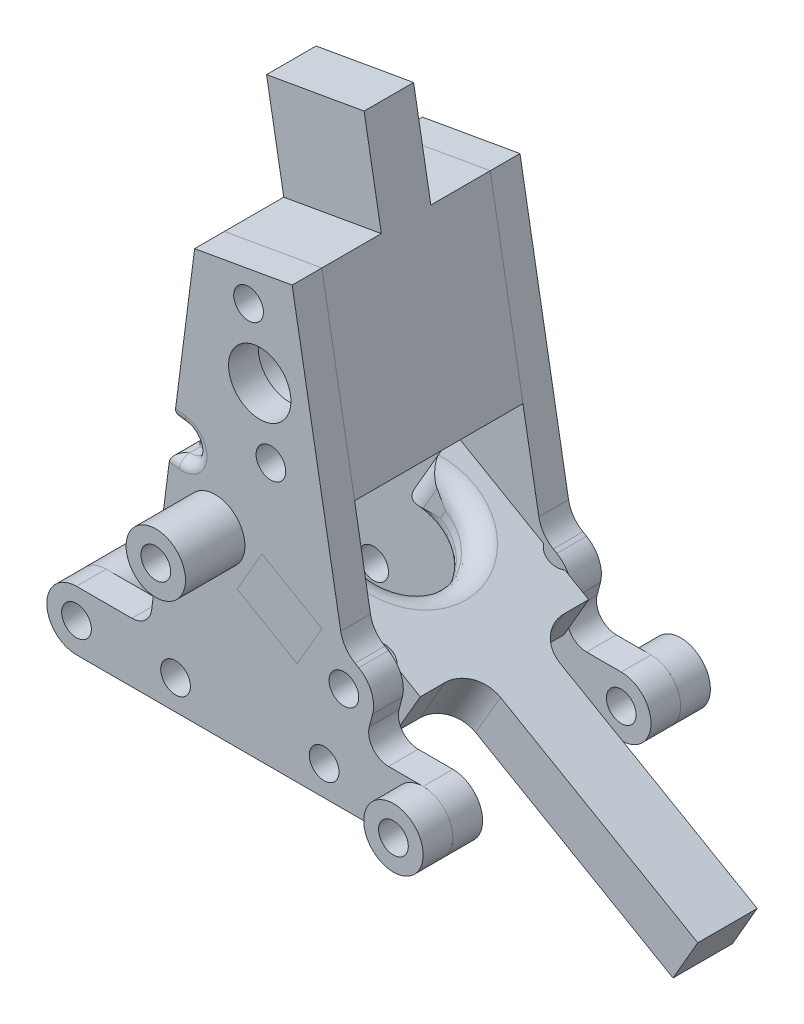
from build123d import *

# Parameters (mm, degrees)
SKETCH_1_R             = 1.5
SKETCH_1_R_2           = 3.15
EXTRUDE_1_DEPTH        = 3
EXTRUDE_START          = -3
SKETCH_6_R             = 1.5
EXTRUDE_5_DEPTH        = 3
FILLET_2_R             = 2
CUT_EXTRUDE_3_DEPTH    = 50.101561086
FILLET_5_R             = 1
PATTERN_LINEAR_1_COUNT = 2
PATTERN_LINEAR_1_PITCH = 20
EXTRUDE_2_REACH        = 54.934
SKETCH_2_R             = 3.45
SKETCH_2_R_2           = 1.6
SKETCH_3_W             = 10
SKETCH_3_H             = 5
EXTRUDE_3_DEPTH        = 10
EXTRUDE_4_DEPTH        = 2.5
OTHER_START            = -0.045495013
OTHER_1_OUTLINE_W      = 5
OTHER_1_OUTLINE_H      = 3
OTHER_1_DEPTH          = 7
OTHER_2_OUTLINE_W      = 5
OTHER_2_OUTLINE_H      = 3
OTHER_2_DEPTH          = 7
FILLET_1_R             = 3
CHAMFER_1_SIZE         = 3
SKETCH_8_R             = 3
SKETCH_8_R_2           = 1.5
EXTRUDE_6_DEPTH        = 17
SKETCH_9_R             = 1.25
CUT_EXTRUDE_1_DEPTH    = 5
CUT_EXTRUDE_2_REACH    = 55.629
SKETCH_11_R            = 3
SKETCH_11_R_2          = 1.5
EXTRUDE_7_DEPTH        = 6
SKETCH_12_R            = 3
SKETCH_12_R_2          = 1.5
EXTRUDE_8_DEPTH        = 3
FILLET_3_R             = 2
FILLET_4_R             = 2


# Read off the part's stored shape, not the designer's step: ｲﾝﾃﾞﾝﾄ1, ｲﾝﾃﾞﾝﾄ2
# Some blends are built 0.0001 mm under size
with BuildPart() as part:
    # ｽｹｯﾁ1 → ﾎﾞｽ - 押し出し1 (new body)
    with BuildSketch(Plane.XY):
        with BuildLine():
            Line((1.926303547, 38.487432765), (11.774381077, 40.223914542))
            Line((11.774381077, 40.223914542), (16.678379769, 12.411955915))
            ThreePointArc((16.678379769, 12.411955915), (17.175346896, 11.212171139), (18.132803029, 10.334824237))
            Line((18.132803029, 10.334824237), (18.495190528, 10.125599716))
            ThreePointArc((18.495190528, 10.125599716), (19.765274197, 8.679320566), (19.895057261, 6.75890596))
            Line((19.895057261, 6.75890596), (17.899866733, -0.768617545))
            ThreePointArc((17.899866733, -0.768617545), (16.829500938, -2.377588341), (15, -3))
            Line((15, -3), (0, -3))
            ThreePointArc((0, -3), (-2.252587178, -1.981376038), (-2.975481506, 0.382765997))
            Line((-2.975481506, 0.382765997), (1.926303547, 38.487432765))
        make_face()
        Circle(SKETCH_1_R, mode=Mode.SUBTRACT)
        with Locations((15, 0)):
            Circle(SKETCH_1_R, mode=Mode.SUBTRACT)
        with Locations((16.995190528, 7.527523505)):
            Circle(SKETCH_1_R, mode=Mode.SUBTRACT)
        with Locations((4.004809472, 15.027523505)):
            Circle(SKETCH_1_R, mode=Mode.SUBTRACT)
        with Locations((8.5, 30)):
            Circle(SKETCH_1_R_2, mode=Mode.SUBTRACT)
        with Locations((7.371286845, 36.401250395)):
            Circle(SKETCH_1_R, mode=Mode.SUBTRACT)
        with Locations(Location((9.628713155, 23.598749605, 0), (0, 0, 180))):
            Circle(SKETCH_1_R, mode=Mode.SUBTRACT)
    extrude(amount=EXTRUDE_1_DEPTH)

    # ｽｹｯﾁ6 → ﾎﾞｽ - 押し出し5 (add)
    # profile 1 of 2: a face of its own
    with BuildSketch(Plane.XY.offset(3).offset(EXTRUDE_START)):
        with BuildLine():
            Line((-2.638800474, 3), (-10, 3))
            ThreePointArc((-10, 3), (-13, 0), (-10, -3))
            Line((-10, -3), (0, -3))
            ThreePointArc((0, -3), (-2.252587178, -1.981376038), (-2.975481506, 0.382765997))
            Line((-2.975481506, 0.382765997), (-2.638800474, 3))
        make_face()
        with Locations((-10, 0)):
            Circle(SKETCH_6_R, mode=Mode.SUBTRACT)
    # profile 2 of 2: a face of its own
    with BuildSketch(Plane.XY.offset(3).offset(EXTRUDE_START)):
        with BuildLine():
            Line((15, -3), (25, -3))
            ThreePointArc((25, -3), (28, 0), (25, 3))
            Line((25, 3), (18.898749038, 3))
            Line((18.898749038, 3), (17.899866733, -0.768617545))
            ThreePointArc((17.899866733, -0.768617545), (16.829500938, -2.377588341), (15, -3))
        make_face()
        with Locations((25, 0)):
            Circle(SKETCH_6_R, mode=Mode.SUBTRACT)
    extrude(amount=EXTRUDE_5_DEPTH)

    # ﾌｨﾚｯﾄ2
    fillet_2_edges = [part.edges().sort_by_distance(p)[0] for p in [
        (18.898749038, 3, 1.5),
        (-2.638800474, 3, 1.5),
    ]]
    fillet(fillet_2_edges, radius=FILLET_2_R)

    # ｽｹｯﾁ13 → ｶｯﾄ - 押し出し3 (cut, through all)
    with BuildSketch(Plane.XY.offset(3)):
        with BuildLine():
            Line((-1.117064807, 22.667097894), (0.866589531, 22.411920563))
            ThreePointArc((0.866589531, 22.411920563), (2.162947285, 20.732796811), (0.483823534, 19.436439057))
            Line((0.483823534, 19.436439057), (-1.499830804, 19.691616388))
            ThreePointArc((-1.499830804, 19.691616388), (-2.796188558, 21.37074014), (-1.117064807, 22.667097894))
        make_face()
    extrude(amount=-CUT_EXTRUDE_3_DEPTH, mode=Mode.SUBTRACT)

    # ﾌｨﾚｯﾄ5
    fillet_5_edges = [part.edges().sort_by_distance(p)[0] for p in [
        (-0.508003635, 19.564027723, 1.5),
        (-0.125237638, 22.539509228, 1.5),
        (0.370675946, 22.475714896, 0),
        (-0.012090051, 19.50023339, 0),
        (0.370675946, 22.475714896, 3),
        (-0.012090051, 19.50023339, 3),
        (2.162947285, 20.732796811, 3),
        (2.162947285, 20.732796811, 0),
    ]]
    fillet(fillet_5_edges, radius=FILLET_5_R - 0.0001)  # a hair under: the kernel refuses the full size


with BuildPart() as pattern_linear_1_1:
    # 直線ﾊﾟﾀｰﾝ1: pattern copy
    add(part.part.moved(Location(Vector(0, 0, -1) * (1 * PATTERN_LINEAR_1_PITCH))))


with BuildPart() as body_3:

    # ｽｹｯﾁ2 → ﾎﾞｽ - 押し出し2 (new, up to next)
    with BuildSketch(Plane(origin=(0, 0, 0), x_dir=(-1, 0, 0), z_dir=(0, 0, -1)), mode=Mode.PRIVATE) as extrude_2_sk1:
        Polygon((-1.926303547, 38.487432765), (-5.225618923, 19.776085458), (-15.073696453, 21.512567235), (-11.774381077, 40.223914542), align=None)
        with Locations(Location((-8.5, 30, 0), (0, 0, 180))):
            Circle(SKETCH_2_R, mode=Mode.SUBTRACT)
        with Locations(Location((-7.371286845, 36.401250395, 0), (0, 0, 180))):
            Circle(SKETCH_2_R_2, mode=Mode.SUBTRACT)
        with Locations(Location((-9.628713155, 23.598749605, 0), (0, 0, 180))):
            Circle(SKETCH_2_R_2, mode=Mode.SUBTRACT)
    extrude_2_tool1 = extrude(extrude_2_sk1.sketch, amount=EXTRUDE_2_REACH, mode=Mode.PRIVATE) - pattern_linear_1_1.part
    add(extrude_2_tool1.solids().sort_by_distance((3.815366, 29.173973, 0))[0])

    # ｽｹｯﾁ3 → ﾎﾞｽ - 押し出し3 (add)
    with BuildSketch(Plane(origin=(-6.523653476, 36.997477356, 0), x_dir=(0.9848077530122074, 0.1736481776669345, 0), z_dir=(-0.1736481776669345, 0.9848077530122074, 0))):
        with Locations((13.580311231, 8.5)):
            Rectangle(SKETCH_3_W, SKETCH_3_H)
    extrude(amount=EXTRUDE_3_DEPTH)

    # 面取り1
    chamfer_1_edges = [body_3.edges().sort_by_distance(p)[0] for p in [
        (5.225618923, 19.776085458, -8.5),
    ]]
    chamfer(chamfer_1_edges, length=CHAMFER_1_SIZE)


with BuildPart() as body_4:
    # ｽｹｯﾁ5 → ﾎﾞｽ - 押し出し4 (new, symmetric)
    with BuildSketch(Plane(origin=(7.508310924, 13.004775999, 0), x_dir=(0.8660254037844419, -0.49999999999999445, 0), z_dir=(-0.49999999999999445, -0.8660254037844419, 0))):
        with BuildLine():
            Line((14.954504987, 0), (6.954504987, 0))
            Line((6.954504987, 0), (6.954504987, 3))
            Line((6.954504987, 3), (-0.045495013, 3))
            Line((-0.045495013, 3), (-0.045495013, 0))
            Line((-0.045495013, 0), (-0.045495013, -3.5))
            Line((-0.045495013, -3.5), (3.454504987, -3.5))
            ThreePointArc((3.454504987, -3.5), (8.454504987, -8.5), (3.454504987, -13.5))
            Line((3.454504987, -13.5), (-0.045495013, -13.5))
            Line((-0.045495013, -13.5), (-0.045495013, -17))
            Line((-0.045495013, -17), (-0.045495013, -20))
            Line((-0.045495013, -20), (6.954504987, -20))
            Line((6.954504987, -20), (6.954504987, -17))
            Line((6.954504987, -17), (14.954504987, -17))
            Line((14.954504987, -17), (14.954504987, -11.5))
            Line((14.954504987, -11.5), (40.954504987, -11.5))
            Line((40.954504987, -11.5), (40.954504987, -5.5))
            Line((40.954504987, -5.5), (14.954504987, -5.5))
            Line((14.954504987, -5.5), (14.954504987, 0))
        make_face()
    extrude(amount=EXTRUDE_4_DEPTH, both=True)

    # ﾌｨﾚｯﾄ1
    fillet_1_edges = [body_4.edges().sort_by_distance(p)[0] for p in [
        (20.459292144, 5.527523505, -5.5),
        (20.459292144, 5.527523505, -11.5),
    ]]
    fillet(fillet_1_edges, radius=FILLET_1_R)

    # ｽｹｯﾁ9 → ｶｯﾄ - 押し出し1 (cut)
    with BuildSketch(Plane.XY):
        with Locations((16.995190528, 7.527523505)):
            Circle(SKETCH_9_R)
    cut_extrude_1 = extrude(amount=-CUT_EXTRUDE_1_DEPTH, mode=Mode.SUBTRACT)

    # ｶｯﾄ - 押し出し2: up to this face of the body (flat: up to its plane)
    cut_extrude_2_end = Plane(body_4.part.faces().sort_by_distance((20.266625746, 2.752008156, -8.5))[0])
    # ｽｹｯﾁ10 → ｶｯﾄ - 押し出し2 (cut, up to the picked face)
    with BuildSketch(Plane(origin=(8.758310924, 15.169839508, 0), x_dir=(0.8660254037844419, -0.4999999999999945, 0), z_dir=(0.49999999999999445, 0.8660254037844418, 0)), mode=Mode.PRIVATE) as cut_extrude_2_sk1:
        with BuildLine():
            Line((9.704504987, 0), (12.204504987, 0))
            ThreePointArc((12.204504987, 0), (10.954504987, 0.601250782), (9.704504987, 0))
        make_face()
    cut_extrude_2_tool1 = split(extrude(cut_extrude_2_sk1.sketch, amount=-CUT_EXTRUDE_2_REACH, mode=Mode.PRIVATE), bisect_by=cut_extrude_2_end, keep=Keep.BOTH, mode=Mode.PRIVATE)
    cut_extrude_2 = cut_extrude_2_tool1.solids().sort_by(Axis((18.245191, 9.692587, -0.24485), (-0.49999999999999445, -0.8660254037844418, 0)))[0]
    add(cut_extrude_2, mode=Mode.SUBTRACT)

    # ﾐﾗｰ1: ｶｯﾄ - 押し出し1, ｶｯﾄ - 押し出し2 across plane
    add(cut_extrude_1.mirror(Plane.XY.offset(-8.5)), mode=Mode.SUBTRACT)
    add(cut_extrude_2.mirror(Plane.XY.offset(-8.5)), mode=Mode.SUBTRACT)

    # ﾌｨﾚｯﾄ3
    fillet_3_edges = [body_4.edges().sort_by_distance(p)[0] for p in [
        (7.468911087, 13.027523505, -13.5),
        (7.468911087, 13.027523505, -3.5),
    ]]
    fillet(fillet_3_edges, radius=FILLET_3_R)

    # ﾌｨﾚｯﾄ4
    # the kernel refuses this fillet: 2 mm, written as the material it takes off along each edge
    with BuildSketch(Plane(origin=(11.75, 13.442587014, -8.5), x_dir=(-0.7294868033488365, 0.42116940228372385, 0.538948363314953), z_dir=(-0.46674297395879627, 0.2694741816574735, -0.8423388045674575))) as fillet_4_piece_1:
        with BuildLine():
            CenterArc((5 + FILLET_4_R, -FILLET_4_R), FILLET_4_R, 90, 90)
            Line((5, -FILLET_4_R), (5, 0))
            Line((5, 0), (5 + FILLET_4_R, 0))
        make_face()
    revolve(axis=Axis((11.75, 13.442587014, -8.5), (0.49999999999999445, 0.8660254037844419, 0)), revolution_arc=294.775843921, mode=Mode.SUBTRACT)
    with BuildSketch(Plane(origin=(9.25, 9.112459995, -8.5), x_dir=(-0.7294868033488374, 0.4211694022837243, 0.5389483633149517), z_dir=(-0.4667429739587951, 0.26947418165747283, -0.8423388045674585))) as fillet_4_piece_2:
        with BuildLine():
            CenterArc((5 + FILLET_4_R, FILLET_4_R), FILLET_4_R, 180, 90)
            Line((5 + FILLET_4_R, 0), (5, 0))
            Line((5, 0), (5, FILLET_4_R))
        make_face()
    revolve(axis=Axis((9.25, 9.112459995, -8.5), (0.49999999999999445, 0.8660254037844419, 0)), revolution_arc=294.775843921, mode=Mode.SUBTRACT)


with BuildPart() as part_1:
    add(part.part)

    # ｲﾝﾃﾞﾝﾄ1 outline → ｲﾝﾃﾞﾝﾄ1 (cut)
    with BuildSketch(Plane(origin=(0, 0, 0), x_dir=(0.4999999999999938, 0.8660254037844423, 0), z_dir=(0.8660254037844421, -0.49999999999999406, 0)).offset(OTHER_START)):
        with Locations((15.016621847, 1.5)):
            Rectangle(OTHER_1_OUTLINE_W, OTHER_1_OUTLINE_H)
    extrude(amount=OTHER_1_DEPTH, mode=Mode.SUBTRACT)


with BuildPart() as pattern_linear_1_1_1:
    add(pattern_linear_1_1.part)

    # ｲﾝﾃﾞﾝﾄ2 outline → ｲﾝﾃﾞﾝﾄ2 (cut)
    with BuildSketch(Plane(origin=(0, 0, 0), x_dir=(0.4999999999999938, 0.8660254037844423, 0), z_dir=(0.8660254037844421, -0.49999999999999406, 0)).offset(OTHER_START)):
        with Locations((15.016621847, -18.5)):
            Rectangle(OTHER_2_OUTLINE_W, OTHER_2_OUTLINE_H)
    extrude(amount=OTHER_2_DEPTH, mode=Mode.SUBTRACT)


with BuildPart() as body_5:
    # ｽｹｯﾁ8 → ﾎﾞｽ - 押し出し6 (new body)
    with BuildSketch(Plane.XY.offset(-17)):
        with Locations((-10, 0)):
            Circle(SKETCH_8_R)
        with Locations((-10, 0)):
            Circle(SKETCH_8_R_2, mode=Mode.SUBTRACT)
    extrude(amount=EXTRUDE_6_DEPTH)


with BuildPart() as body_6:
    # ｽｹｯﾁ11 → ﾎﾞｽ - 押し出し7 (new body)
    with BuildSketch(Plane.XY.offset(3)):
        with Locations((4.004809472, 15.027523505)):
            Circle(SKETCH_11_R)
        with Locations((4.004809472, 15.027523505)):
            Circle(SKETCH_11_R_2, mode=Mode.SUBTRACT)
    extrude(amount=EXTRUDE_7_DEPTH)


with BuildPart() as body_7:
    # ｽｹｯﾁ12 → ﾎﾞｽ - 押し出し8 (new body)
    with BuildSketch(Plane.XY.offset(3)):
        with Locations((25, 0)):
            Circle(SKETCH_12_R)
        with Locations((25, 0)):
            Circle(SKETCH_12_R_2, mode=Mode.SUBTRACT)
    extrude(amount=EXTRUDE_8_DEPTH)


with BuildPart() as body_8:
    # ﾐﾗｰ2: mirrored copy
    add(body_6.part.mirror(Plane.XY.offset(-8.5)))


with BuildPart() as body_9:
    # Mirror 2 2: mirrored copy
    add(body_7.part.mirror(Plane.XY.offset(-8.5)))


solid = Compound([body_3.part, body_4.part, part_1.part, pattern_linear_1_1_1.part, body_5.part, body_6.part, body_7.part, body_8.part, body_9.part])
